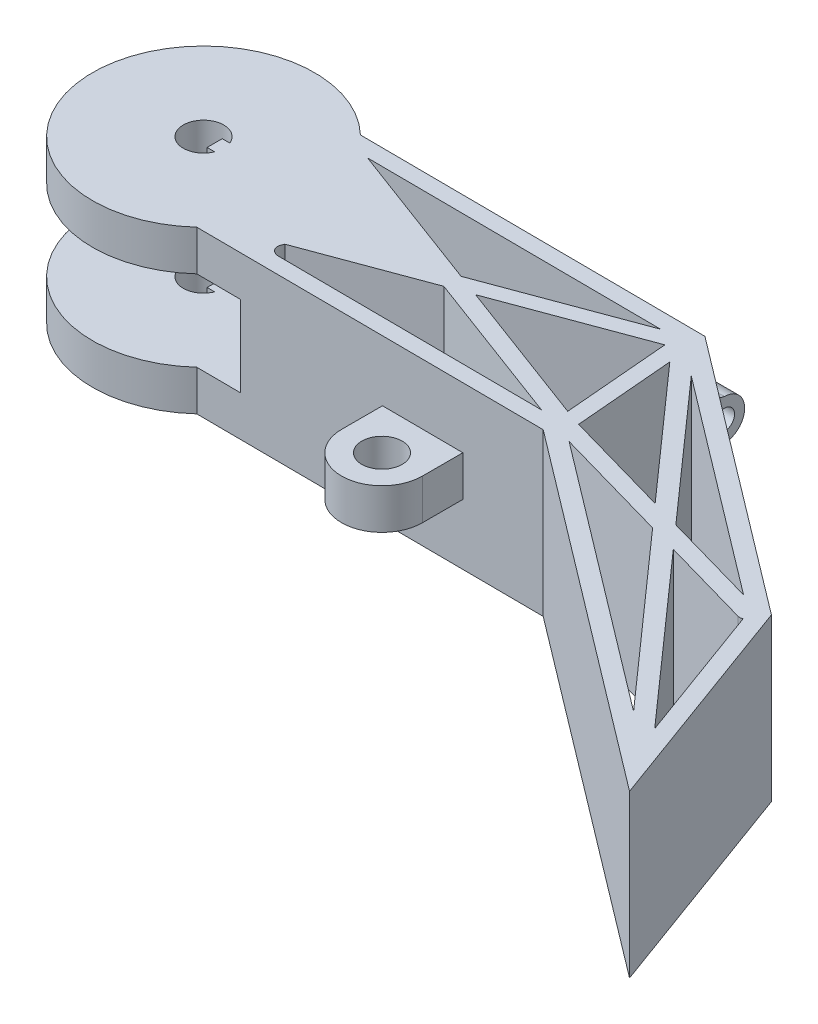
from build123d import *

# Parameters (mm, degrees)
BOSS_EXTRUDE4_DEPTH      = 12.7
SKETCH4_R                = 17.653445752
CUT_EXTRUDE1_DEPTH       = 6.35
CUT_EXTRUDE2_DEPTH       = 6.35
CUT_EXTRUDE5_DEPTH       = 109.881733746
BOSS_EXTRUDE6_DEPTH      = 3.175
BOSS_EXTRUDE6_DEPTH_BACK = 3.175
SKETCH9_R                = 1.5875
BOSS_EXTRUDE7_DEPTH      = 3.175
BOSS_EXTRUDE7_DEPTH_BACK = 3.175
SKETCH10_R               = 3.175


with BuildPart() as part:
    # Sketch2 → Boss-Extrude4 (new body)
    with BuildSketch(Plane(origin=(0, 0, 0), x_dir=(1, 0, 0), z_dir=(0, 1, 0))):
        with BuildLine():
            Line((-2.387880417, -18.841306965), (53.578976921, -61.247629626))
            Line((53.578976921, -61.247629626), (40.727486813, -26.109986808))
            Line((40.727486813, -26.109986808), (-2.387867851, 6.558698348))
            Line((-2.387867851, 6.558698348), (-56.830809788, 6.896210087))
            ThreePointArc((-56.830809788, 6.896210087), (-86.36301081, -5.439598854), (-57.144853521, -18.501848432))
            Line((-57.144853521, -18.501848432), (-2.387880417, -18.841306965))
        make_face()
        with BuildLine():
            Line((-65.987192171, -6.845774662), (-67.177817171, -6.845774662))
            Line((-67.177817171, -6.845774662), (-67.177817171, -4.464524662))
            Line((-67.177817171, -4.464524662), (-65.987192171, -4.464524662))
            ThreePointArc((-65.987192171, -4.464524662), (-72.105495945, -5.655149662), (-65.987192171, -6.845774662))
        make_face(mode=Mode.SUBTRACT)
    boss_extrude4 = extrude(amount=BOSS_EXTRUDE4_DEPTH)

    # Sketch4 → Cut-Extrude1 (cut)
    with BuildSketch(Plane(origin=(0, 12.7, 0), x_dir=(1, 0, 0), z_dir=(0, 1, 0))):
        with Locations((-68.930495945, -5.655149662)):
            Circle(SKETCH4_R)
    cut_extrude1 = extrude(amount=-CUT_EXTRUDE1_DEPTH, mode=Mode.SUBTRACT)

    # Triangleout → Cut-Extrude2 (cut)
    with BuildSketch(Plane(origin=(0, 6.35, 0), x_dir=(1, 0, 0), z_dir=(0, 1, 0))):
        Polygon((-58.106305107, -19.510345754), (-49.809105951, -19.510345754), (-52.888981235, -13.024949709), align=None)
    cut_extrude2 = extrude(amount=CUT_EXTRUDE2_DEPTH, mode=Mode.SUBTRACT)

    # Mirror3: Boss-Extrude4, Cut-Extrude1, Cut-Extrude2 across plane
    add(boss_extrude4.mirror(Plane(origin=(-68.930495945, 12.7, 5.655149662), x_dir=(0, 0, 1), z_dir=(0, -1, 0))))
    add(cut_extrude1.mirror(Plane(origin=(-68.930495945, 12.7, 5.655149662), x_dir=(0, 0, 1), z_dir=(0, -1, 0))), mode=Mode.SUBTRACT)
    add(cut_extrude2.mirror(Plane(origin=(-68.930495945, 12.7, 5.655149662), x_dir=(0, 0, 1), z_dir=(0, -1, 0))), mode=Mode.SUBTRACT)

    # Sketch5 → Cut-Extrude5 (cut, through all)
    with BuildSketch(Plane(origin=(0, 25.4, 0), x_dir=(1, 0, 0), z_dir=(0, 1, 0))):
        with BuildLine():
            Line((24.099631315, -24.892755187), (47.034088631, -50.747669189))
            Line((47.034088631, -50.747669189), (39.03471101, -28.876331991))
            ThreePointArc((39.03471101, -28.876331991), (38.645676848, -28.952727466), (38.252042628, -28.905441646))
            Line((38.252042628, -28.905441646), (24.099631315, -24.892755187))
        make_face()
        Polygon((1.256640277, -18.415995941), (43.047568139, -50.081157351), (19.563456511, -23.606596468), align=None)
        Polygon((-0.335913055, -15.324329604), (16.434626788, -20.079343901), (-1.660316127, 0.319795544), align=None)
        Polygon((1.929156818, 0.100890993), (20.970801592, -21.365502621), (35.814534972, -25.574202228), align=None)
        with BuildLine():
            Line((-47.081442632, -16.024186394), (-5.218084554, -16.283712685))
            Line((-5.218084554, -16.283712685), (-29.69599423, -7.140722356))
            Line((-29.69599423, -7.140722356), (-47.914378424, -13.898443659))
            add(Edge.make_bspline(
                [(-47.081442632, -16.024186394), (-48.684668247, -15.466043094), (-47.914378424, -13.898443659)],
                knots=[0, 0, 0, 1, 1, 1], degree=2))
        make_face()
        Polygon((-26.05383136, -5.78973967), (-2.9619803, -14.4150093), (-4.373004357, 2.252300993), align=None)
        Polygon((-29.692909923, -4.430470821), (-6.840209692, 4.046251237), (-53.155770657, 4.333378365), align=None)
    extrude(amount=-CUT_EXTRUDE5_DEPTH, mode=Mode.SUBTRACT)

    # Sketch10 → Boss-Extrude7 (add, two sides: drawn at the far end of the back side and taken through both)
    with BuildSketch(Plane.XZ.offset(-12.7).offset(-BOSS_EXTRUDE7_DEPTH_BACK)):
        with BuildLine():
            Line((-27.787880417, 18.683843062), (-15.087880417, 18.762575013))
            Line((-15.087880417, 18.762575013), (-15.087880417, 25.112575013))
            ThreePointArc((-15.087880417, 25.112575013), (-21.437880417, 31.462575013), (-27.787880417, 25.112575013))
            Line((-27.787880417, 25.112575013), (-27.787880417, 18.683843062))
        make_face()
        with Locations((-21.437880417, 25.112575013)):
            Circle(SKETCH10_R, mode=Mode.SUBTRACT)
    extrude(amount=BOSS_EXTRUDE7_DEPTH + BOSS_EXTRUDE7_DEPTH_BACK)


with BuildPart() as body_2:
    # Sketch9 → Boss-Extrude6 (new, two sides: drawn at the far end of the back side and taken through both)
    with BuildSketch(Plane.ZY.offset(5.367363181).offset(-BOSS_EXTRUDE6_DEPTH_BACK)):
        with BuildLine():
            Line((-6.281503167, 20.031440199), (-6.281503167, 5.865230329))
            add(Edge.make_bspline(
                [(-9.434249221, 9.525), (-7.135953737, 8.991490375), (-6.281503167, 5.865230329)],
                knots=[0, 0, 0, 1, 1, 1], degree=2))
            ThreePointArc((-9.434249221, 9.525), (-12.609249221, 12.7), (-9.434249221, 15.875))
            add(Edge.make_bspline(
                [(-9.434249221, 15.875), (-7.094182624, 16.228973698), (-6.281503167, 20.031440199)],
                knots=[0, 0, 0, 1, 1, 1], degree=2))
        make_face()
        with Locations((-9.434249221, 12.7)):
            Circle(SKETCH9_R, mode=Mode.SUBTRACT)
    extrude(amount=BOSS_EXTRUDE6_DEPTH + BOSS_EXTRUDE6_DEPTH_BACK)


solid = Compound([part.part, body_2.part])
